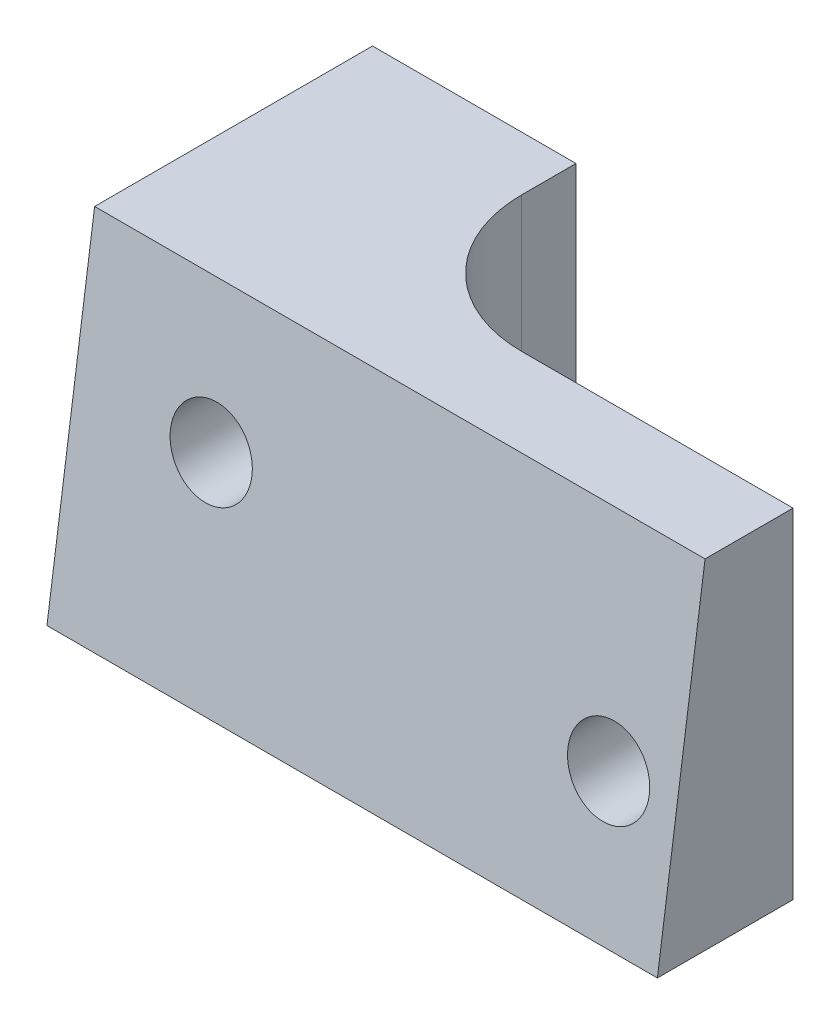
from build123d import *

# Parameters (mm, degrees)
SKETCH1_W           = 15
SKETCH1_H           = 15
SKETCH1_R           = 3
BOSS_EXTRUDE1_DEPTH = 24
SKETCH1_3_W         = 45
SKETCH1_3_H         = 25
SKETCH1_3_R         = 3
BOSS_EXTRUDE2_DEPTH = 10
CUT_EXTRUDE1_DEPTH  = 57.797887285
FILLET2_R           = 10


with BuildPart() as part:
    # Sketch1 → Boss-Extrude1 (new body)
    with BuildSketch(Plane.XY):
        with Locations((7.5, 17.5)):
            Rectangle(SKETCH1_W, SKETCH1_H)
        with Locations((10, 15)):
            Circle(SKETCH1_R, mode=Mode.SUBTRACT)
    extrude(amount=-BOSS_EXTRUDE1_DEPTH)

    # Sketch1<3> → Boss-Extrude2 (add)
    with BuildSketch(Plane.XY):
        with Locations((22.5, 12.5)):
            Rectangle(SKETCH1_3_W, SKETCH1_3_H)
        with Locations((10, 15)):
            Circle(SKETCH1_3_R, mode=Mode.SUBTRACT)
        with Locations((40, 10)):
            Circle(SKETCH1_3_R, mode=Mode.SUBTRACT)
    extrude(amount=-BOSS_EXTRUDE2_DEPTH)

    # Sketch2 → Cut-Extrude1 (cut, through all)
    with BuildSketch(Plane(origin=(45, 0, 0), x_dir=(0, 0, -1), z_dir=(1, 0, 0))):
        Polygon((0, 0), (3.513520868, 25), (0, 25), align=None)
    extrude(amount=-CUT_EXTRUDE1_DEPTH, mode=Mode.SUBTRACT)

    # Fillet2
    fillet2_edges = [part.edges().sort_by_distance(p)[0] for p in [
        (7.5, 10, -10),
        (15, 17.5, -10),
    ]]
    fillet(fillet2_edges, radius=FILLET2_R - 0.0001)  # a hair under: the kernel refuses the full size


solid = part.part
